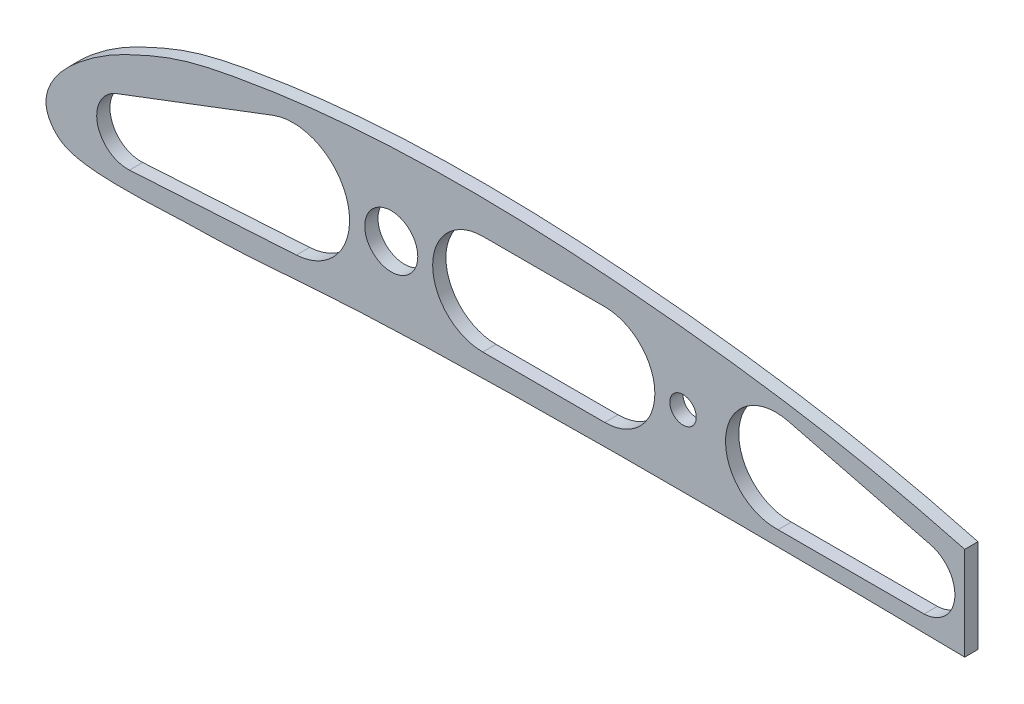
from build123d import *

# Parameters (mm, degrees)
BOSS_EXTRUDE1_DEPTH      = 1.5875
BOSS_EXTRUDE1_DEPTH_BACK = 1.5875
SKETCH1_R                = 6.35
SKETCH1_R_2              = 3.175
CUT_EXTRUDE2_DEPTH       = 41.720661094
CUT_EXTRUDE5_START       = -1.5875
CUT_EXTRUDE5_OUTLINE_R   = 3.175
CUT_EXTRUDE5_DEPTH       = 3.175


# Read off the part's stored shape, not the designer's step: Cut-Extrude5
with BuildPart() as part:
    # Sketch1 → Boss-Extrude1 (new, two sides: drawn at the far end of the back side and taken through both)
    with BuildSketch(Plane.XY.offset(-BOSS_EXTRUDE1_DEPTH_BACK)):
        with BuildLine():
            add(Edge.make_bspline(
                [(304.8, 0), (305.077640245, 0.670235949), (287.206651558, 5.720143468), (270.662795429, 11.397054489), (243.463273842, 19.4859206), (213.747912645, 28.209957225), (183.040246216, 34.676594881), (152.491946525, 38.62898995), (121.966980877, 41.172895409), (91.414928066, 41.723012749), (65.927495496, 40.062013506), (45.625003822, 37.00459991), (32.727710355, 34.352142796), (22.731795616, 30.196529044), (14.907225707, 26.461250588), (8.516283527, 21.964417846), (2.537455581, 16.488464455), (-1.964479894, 8.893906893), (2.841930098, 2.334923028), (8.778829491, 0.629027732), (15.228793663, 0.221834685), (22.863576464, 0.239109806), (33.015631673, 0.788100742), (45.740419078, 0.855312608), (66.018396979, 2.65839435), (91.426578086, 3.794926314), (121.91527013, 4.332217391), (152.40834867, 4.479066808), (182.849810214, 4.269103649), (213.479164171, 4.047670271), (243.430144592, 3.313971789), (270.486497521, 1.370513613), (287.394329759, 1.442404027), (304.536665057, -0.635702313), (304.8, 0)],
                knots=[0, 0, 0, 0, 0.025556044, 0.050960447, 0.101552747, 0.151805438, 0.201252492, 0.250083002, 0.298629141, 0.347026117, 0.395536064, 0.420002519, 0.444885368, 0.457915187, 0.471441031, 0.48620838, 0.494593531, 0.510948222, 0.521394631, 0.527823606, 0.539981828, 0.552079711, 0.564187269, 0.588393921, 0.612648894, 0.661100879, 0.709502089, 0.757894227, 0.806286364, 0.854680317, 0.903093621, 0.951545605, 0.97576072, 1, 1, 1, 1], degree=3))
        make_face()
        with Locations((82.55, 21.412200012)):
            Circle(SKETCH1_R, mode=Mode.SUBTRACT)
        with Locations((152.4, 21.412200012)):
            Circle(SKETCH1_R_2, mode=Mode.SUBTRACT)
        with Locations((228.6, 13.713637845)):
            Circle(SKETCH1_R_2, mode=Mode.SUBTRACT)
    extrude(amount=BOSS_EXTRUDE1_DEPTH + BOSS_EXTRUDE1_DEPTH_BACK)

    # Sketch2 → Cut-Extrude2 (cut)
    with BuildSketch(Plane.XY.offset(1.5875)):
        with BuildLine():
            Line((104.4575, 33.406185449), (133.6675, 33.406185449))
            ThreePointArc((133.6675, 33.406185449), (145.661485437, 21.412200012), (133.6675, 9.418214575))
            Line((133.6675, 9.418214575), (104.4575, 9.418214575))
            ThreePointArc((104.4575, 9.418214575), (92.463514563, 21.412200012), (104.4575, 33.406185449))
        make_face()
        with BuildLine():
            Line((177.575712719, 31.649714976), (211.50265303, 23.10492457))
            ThreePointArc((211.50265303, 23.10492457), (217.464748261, 14.906681868), (210.11714063, 7.923099332))
            Line((210.11714063, 7.923099332), (175.164881599, 7.923099332))
            ThreePointArc((175.164881599, 7.923099332), (162.64237396, 21.181283902), (177.575712719, 31.649714976))
        make_face()
        with BuildLine():
            Line((19.873308784, 4.839729521), (59.832894927, 7.205034233))
            ThreePointArc((59.832894927, 7.205034233), (72.271895733, 23.557037644), (54.225767066, 33.378137212))
            Line((54.225767066, 33.378137212), (16.804181612, 19.165884286))
            ThreePointArc((16.804181612, 19.165884286), (12.188862773, 10.685302551), (19.873308784, 4.839729521))
        make_face()
    extrude(amount=-CUT_EXTRUDE2_DEPTH, mode=Mode.SUBTRACT)

    # Cut-Extrude5 outline → Cut-Extrude5 (cut)
    with BuildSketch(Plane.XY.offset(CUT_EXTRUDE5_START)):
        with BuildLine():
            Line((219.855455248, 26.205464415), (219.855455249, 3.846240006))
            add(Edge.make_bspline(
                [(219.855455249, 3.846240006), (227.764715213, 3.685916393), (245.753664318, 3.147073338), (270.486497521, 1.370513613), (287.394329759, 1.442404027), (313.577956035, -1.731746917), (287.206651558, 5.720143468), (270.662795429, 11.397054489), (245.778264964, 18.797465358), (227.793808174, 24.085330121), (219.855455248, 26.205464415)],
                knots=[0.865078344, 0.865078344, 0.865078344, 0.865078344, 0.903093621, 0.951545605, 0.97576072, 1, 1.025556044, 1.050960447, 1.101552747, 1.141060167, 1.141060167, 1.141060167, 1.141060167], degree=3))
        make_face()
        with Locations((228.6, 13.713637845)):
            Circle(CUT_EXTRUDE5_OUTLINE_R, mode=Mode.SUBTRACT)
    extrude(amount=CUT_EXTRUDE5_DEPTH, mode=Mode.SUBTRACT)


solid = part.part
